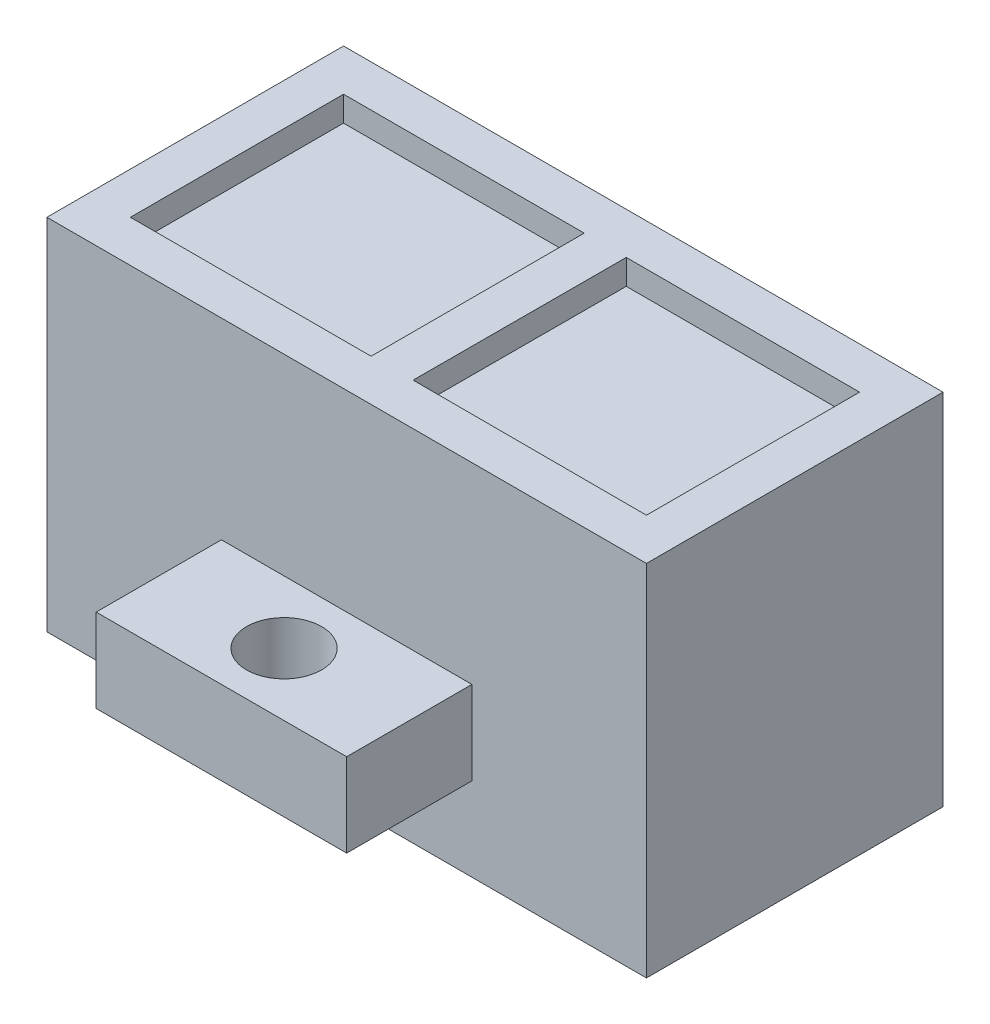
from build123d import *

# Parameters (mm, degrees)
SKETCH_1_R           = 4.5
EXTRUDE_1_DEPTH      = 10
EXTRUDE_2_DEPTH      = 20
EXTRUDE_2_DEPTH_BACK = 20
SKETCH_2_W           = 71.803963936
SKETCH_2_H           = 35.528133462
SKETCH_3_W           = 71.803963936
SKETCH_3_H           = 35.528133462
SKETCH_3_W_2         = 28.82117989
SKETCH_3_H_2         = 25.528133462
EXTRUDE_3_DEPTH      = 3


with BuildPart() as part:
    # 草图1 → 凸台-拉伸1 (new body)
    with BuildSketch(Plane(origin=(0, 0, 0), x_dir=(1, 0, 0), z_dir=(0, 1, 0))):
        Polygon((15, 7.5), (35.901981968, 7.5), (35.901981968, 43.006232026), (-35.901981968, 43.006232026), (-35.901981968, 7.5), (-15, 7.5), (-15, -7.5), (15, -7.5), align=None)
        Circle(SKETCH_1_R, mode=Mode.SUBTRACT)
    extrude(amount=EXTRUDE_1_DEPTH)

    # 草图2 → 凸台-拉伸2 (add, two sides: drawn at the far end of the back side and taken through both)
    with BuildSketch(Plane(origin=(0, 10, 0), x_dir=(1, 0, 0), z_dir=(0, 1, 0)).offset(-EXTRUDE_2_DEPTH_BACK)):
        with Locations((0, 25.264066731)):
            Rectangle(SKETCH_2_W, SKETCH_2_H)
    extrude(amount=EXTRUDE_2_DEPTH + EXTRUDE_2_DEPTH_BACK)

    # 草图3 → 凸台-拉伸3 (add)
    with BuildSketch(Plane(origin=(0, 30, 0), x_dir=(1, 0, 0), z_dir=(0, 1, 0))):
        with Locations((0, 25.264066731)):
            Rectangle(SKETCH_3_W, SKETCH_3_H)
        with Locations((-16.491392023, 25.264066731)):
            Rectangle(SKETCH_3_W_2, SKETCH_3_H_2, mode=Mode.SUBTRACT)
        Polygon((2.956614173, 38.028133462), (30.901981968, 38.028133462), (30.901981968, 12.5), (2.919197968, 12.541080056), align=None, mode=Mode.SUBTRACT)
    extrude(amount=EXTRUDE_3_DEPTH)


solid = part.part
